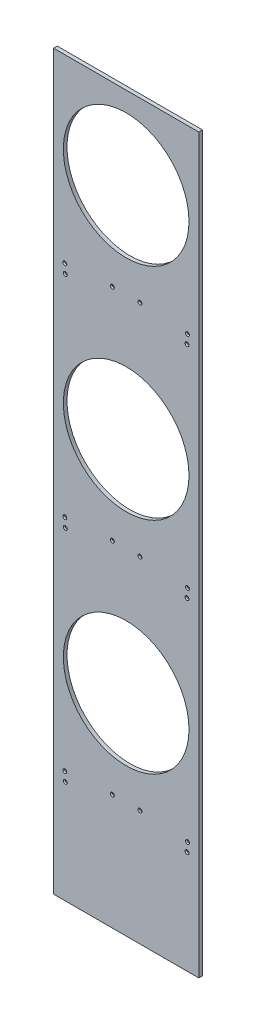
from build123d import *

# Parameters (mm, degrees)
SKETCH1_W                                        = 469.9
SKETCH1_H                                        = 2387.6
SKETCH1_R                                        = 203.2
BOSS_EXTRUDE1_DEPTH                              = 11.90625
CSK_FOR_1_4_FLAT_HEAD_MACHINE_SCREW1_D           = 6.7564
CSK_FOR_1_4_FLAT_HEAD_MACHINE_SCREW1_CSINK_D     = 12.8778
CSK_FOR_1_4_FLAT_HEAD_MACHINE_SCREW1_CSINK_ANGLE = 82
SKETCH4_W                                        = 469.9
SKETCH4_H                                        = 18.25625
CUT_EXTRUDE1_DEPTH                               = 2921.850902257


with BuildPart() as part:
    # Sketch1 → Boss-Extrude1 (new body)
    with BuildSketch(Plane.XY):
        with Locations((2353.31, -159.765072993)):
            Rectangle(SKETCH1_W, SKETCH1_H)
        with Locations((2353.31, -655.065072993)):
            Circle(SKETCH1_R, mode=Mode.SUBTRACT)
        with Locations((2353.31, 56.134927007)):
            Circle(SKETCH1_R, mode=Mode.SUBTRACT)
        with Locations((2353.31, 767.334927007)):
            Circle(SKETCH1_R, mode=Mode.SUBTRACT)
    extrude(amount=BOSS_EXTRUDE1_DEPTH)

    # CSK for 1/4 Flat Head Machine Screw1 (through all)
    with Locations(Plane(origin=(2154.8725, -972.565072993, 11.90625), x_dir=(1, 0, 0), z_dir=(0, 0, 1))):
        with Locations((0, 0), (1.5875, -29.21), (153.9875, 11.1125), (242.8875, 11.1125), (395.2875, -29.21), (396.875, 0), (0, 711.2), (1.5875, 681.99), (153.9875, 722.3125), (242.8875, 722.3125), (395.2875, 681.99), (396.875, 711.2), (0, 1422.4), (1.5875, 1393.19), (153.9875, 1433.5125), (242.8875, 1433.5125), (395.2875, 1393.19), (396.875, 1422.4)):
            CounterSinkHole(CSK_FOR_1_4_FLAT_HEAD_MACHINE_SCREW1_D / 2, CSK_FOR_1_4_FLAT_HEAD_MACHINE_SCREW1_CSINK_D / 2, counter_sink_angle=CSK_FOR_1_4_FLAT_HEAD_MACHINE_SCREW1_CSINK_ANGLE)

    # Sketch4 → Cut-Extrude1 (cut, through all)
    with BuildSketch(Plane.XY.offset(11.90625)):
        with Locations((2353.31, -1344.436947993)):
            Rectangle(SKETCH4_W, SKETCH4_H)
    extrude(amount=-CUT_EXTRUDE1_DEPTH, mode=Mode.SUBTRACT)


solid = part.part
